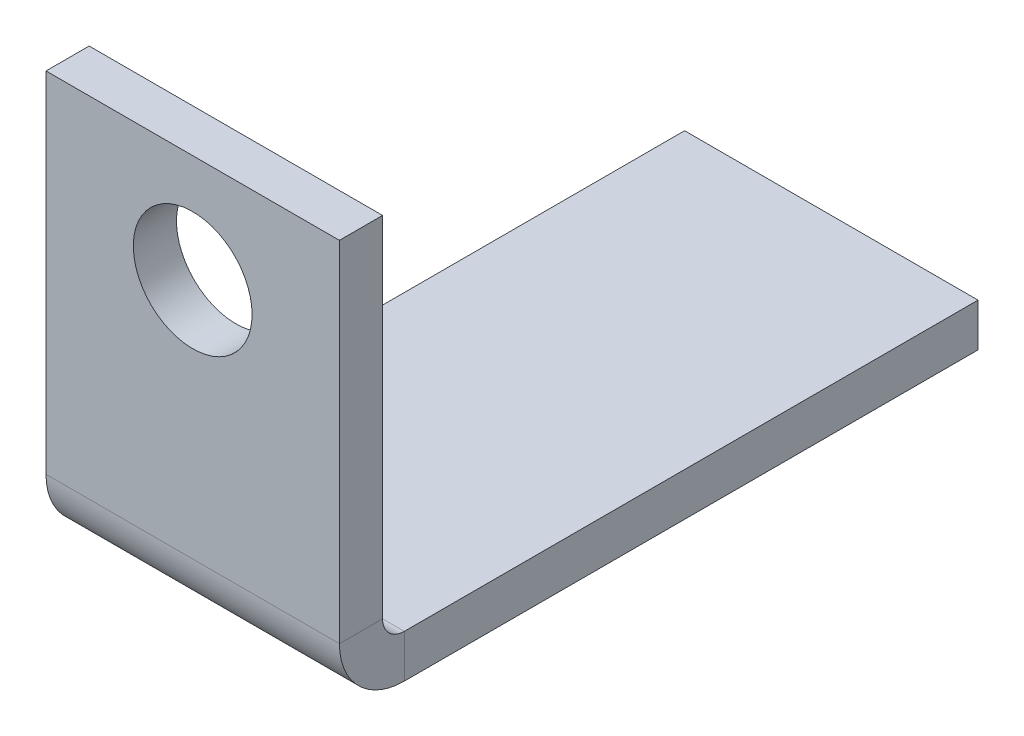
from build123d import *

# Parameters (mm, degrees)
SKETCH1_R                    = 4.3688
BOSS_EXTRUDE1_DEPTH          = 3.175
EDGE_FLANGE1_STRIP_W         = 15.900000204
EDGE_FLANGE1_STRIP_H         = 3.175
EDGE_FLANGE1_STRIP_CUT_DEPTH = 21.59
EDGE_FLANGE1_DEPTH           = 21.59
EDGE_FLANGE1_FLAT_DEPTH      = 3.175


# Sheet-metal steps are written as plain solids
with BuildPart() as part:
    # Sketch1 → Boss-Extrude1 (new body)
    with BuildSketch(Plane.XY):
        Polygon((-10.795, 15.24), (10.795, 15.24), (10.795, -15.24), (-10.795, -15.24), (-10.795, -1.27), align=None)
        with Locations((0, 7.3025)):
            Circle(SKETCH1_R, mode=Mode.SUBTRACT)
    extrude(amount=BOSS_EXTRUDE1_DEPTH)

    # Edge-Flange1 strip (across the edge) → Edge-Flange1 strip cut (cut)
    with BuildSketch(Plane(origin=(10.795, -15.24, 0), x_dir=(0, 1, 0), z_dir=(-1, 0, 0))):
        with Locations((-3.175, -1.5875)):
            Rectangle(EDGE_FLANGE1_STRIP_W, EDGE_FLANGE1_STRIP_H)
    extrude(amount=EDGE_FLANGE1_STRIP_CUT_DEPTH, mode=Mode.SUBTRACT)

    # Edge-Flange1 bend section (across the edge) → Edge-Flange1 (add)
    with BuildSketch(Plane(origin=(10.795, -15.24, 0), x_dir=(0, 1, 0), z_dir=(-1, 0, 0))):
        with BuildLine():
            Line((0, 1.600000102), (3.175, 1.600000102))
            ThreePointArc((3.175, 1.600000102), (3.64362918, 0.46862918), (4.775000102, 0))
            Line((4.775000102, 0), (4.775000102, -3.175))
            ThreePointArc((4.775000102, -3.175), (1.39856515, -1.77643485), (0, 1.600000102))
        make_face()
    extrude(amount=EDGE_FLANGE1_DEPTH)

    # Edge-Flange1 profile (on flange) → Edge-Flange1 flat (add)
    with BuildSketch(Plane(origin=(0, -15.24, 0), x_dir=(1, 0, 0), z_dir=(0, 1, 0))):
        Polygon((-10.795, 1.600000102), (10.795, 1.600000102), (10.795, 13.335), (10.795, 34.925), (10.795, 43.815), (-10.795, 43.815), (-10.795, 34.925), (-10.795, 13.335), align=None)
    extrude(amount=EDGE_FLANGE1_FLAT_DEPTH)


solid = part.part
